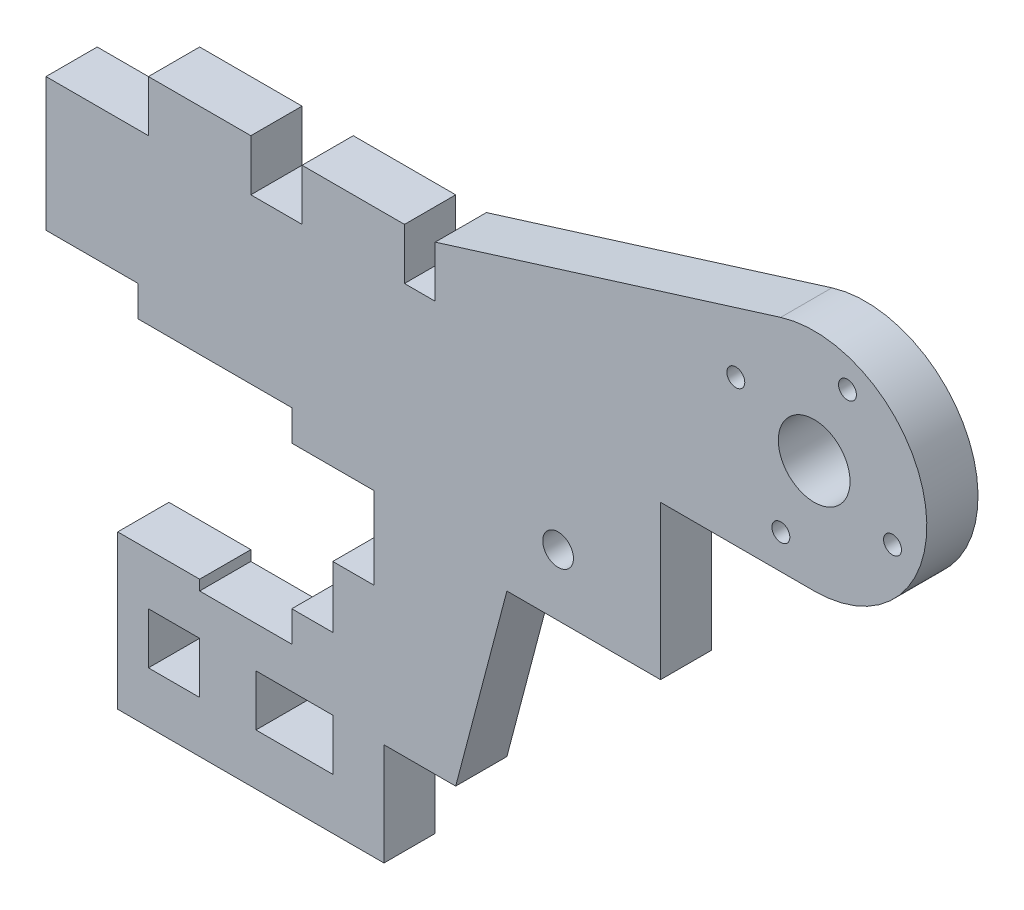
from build123d import *

# Parameters (mm, degrees)
ESQUISSE1_W        = 5
ESQUISSE1_H        = 5
ESQUISSE1_W_2      = 7.5
ESQUISSE1_R        = 1.5
ESQUISSE1_R_2      = 0.875
ESQUISSE1_R_3      = 3.5
BOSS_EXTRU_1_DEPTH = 5


with BuildPart() as part:
    # Esquisse1 → Boss.-Extru.1 (new body)
    with BuildSketch(Plane.XY):
        with BuildLine():
            Line((-8, 5), (-8, -10))
            Line((-8, -10), (18, -10))
            Line((18, -10), (18, 0))
            Line((18, 0), (25, 0))
            Line((25, 0), (30, 19))
            Line((30, 19), (45, 19))
            Line((45, 19), (45, 34))
            Line((45, 34), (60, 34))
            ThreePointArc((60, 34), (70.874947816, 46.653937728), (56.72972973, 55.502634544))
            Line((56.72972973, 55.502634544), (23, 45))
            Line((23, 45), (23, 40))
            Line((23, 40), (20, 40))
            Line((20, 40), (20, 45))
            Line((20, 45), (10, 45))
            Line((10, 45), (10, 40))
            Line((10, 40), (5, 40))
            Line((5, 40), (5, 45))
            Line((5, 45), (-5, 45))
            Line((-5, 45), (-5, 40))
            Line((-5, 40), (-15, 40))
            Line((-15, 40), (-15, 27))
            Line((-15, 27), (-6, 27))
            Line((-6, 27), (-6, 24))
            Line((-6, 24), (9, 24))
            Line((9, 24), (9, 21))
            Line((9, 21), (17, 21))
            Line((17, 21), (17, 13))
            Line((17, 13), (13, 13))
            Line((13, 13), (13, 7))
            Line((13, 7), (9, 7))
            Line((9, 7), (9, 4))
            Line((9, 4), (0, 4))
            Line((0, 4), (0, 5))
            Line((0, 5), (-8, 5))
        make_face()
        with Locations((-2.5, -2.5)):
            Rectangle(ESQUISSE1_W, ESQUISSE1_H, mode=Mode.SUBTRACT)
        with Locations((9.25, -2.5)):
            Rectangle(ESQUISSE1_W_2, ESQUISSE1_H, mode=Mode.SUBTRACT)
        with Locations((35, 25)):
            Circle(ESQUISSE1_R, mode=Mode.SUBTRACT)
        with Locations((56.75, 37.35)):
            Circle(ESQUISSE1_R_2, mode=Mode.SUBTRACT)
        with Locations((60, 45)):
            Circle(ESQUISSE1_R_3, mode=Mode.SUBTRACT)
        with Locations((67.65, 41.75)):
            Circle(ESQUISSE1_R_2, mode=Mode.SUBTRACT)
        with Locations((52.35, 48.25)):
            Circle(ESQUISSE1_R_2, mode=Mode.SUBTRACT)
        with Locations((63.25, 52.65)):
            Circle(ESQUISSE1_R_2, mode=Mode.SUBTRACT)
    extrude(amount=BOSS_EXTRU_1_DEPTH)


solid = part.part
